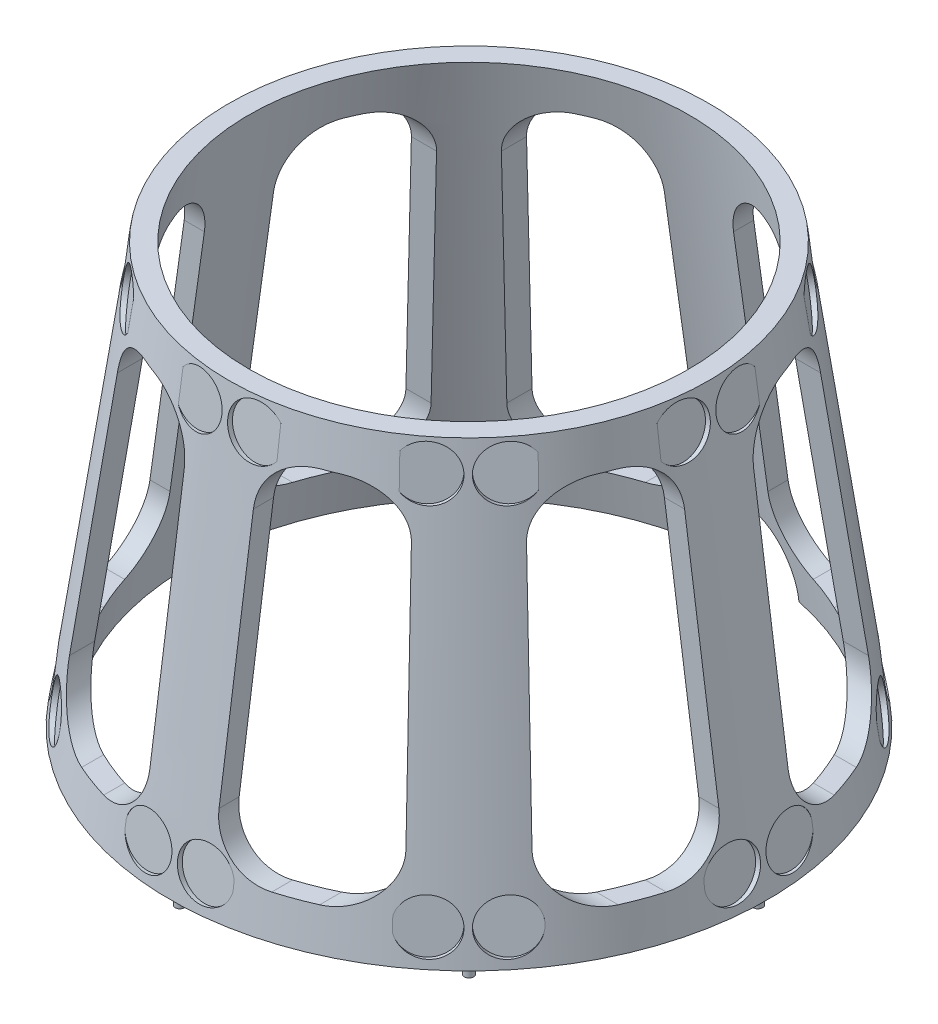
from build123d import *

# Parameters (mm, degrees)
SKIZZE2_R                            = 0.95
AUFSATZ_LINEAR_AUSTRAGEN1_DEPTH      = 2
SCHNITT_LINEAR_AUSTRAGEN1_DEPTH      = 121.644171765
SCHNITT_LINEAR_AUSTRAGEN1_DEPTH_BACK = 121.644171765
SCHNITT_LINEAR_AUSTRAGEN2_DEPTH      = 121.644171936
SCHNITT_LINEAR_AUSTRAGEN2_DEPTH_BACK = 121.644171936
SKIZZE6_R                            = 5.2
SCHNITT_LINEAR_AUSTRAGEN3_DEPTH      = 1
SKIZZE12_R                           = 5.2
SCHNITT_LINEAR_AUSTRAGEN7_DEPTH      = 1
SKIZZE14_R                           = 5.2
SCHNITT_LINEAR_AUSTRAGEN8_DEPTH      = 1
SKIZZE15_R                           = 5.2
SCHNITT_LINEAR_AUSTRAGEN9_DEPTH      = 1
SKIZZE16_R                           = 5.2
SCHNITT_LINEAR_AUSTRAGEN10_DEPTH     = 1
SKIZZE17_R                           = 5.2
SCHNITT_LINEAR_AUSTRAGEN11_DEPTH     = 1
SKIZZE18_R                           = 5.2
SCHNITT_LINEAR_AUSTRAGEN12_DEPTH     = 1
SKIZZE19_R                           = 5.2
SCHNITT_LINEAR_AUSTRAGEN13_DEPTH     = 1
SKIZZE20_R                           = 11.5
SCHNITT_LINEAR_AUSTRAGEN15_DEPTH     = 10


with BuildPart() as part:
    # Skizze1 → Rotation1 (revolve)
    with BuildSketch(Plane(origin=(0, 0, 0), x_dir=(0, 0, -1), z_dir=(1, 0, 0))):
        Polygon((56.5, 0), (44.55402905, 85), (48.59333934, 85), (60.53931029, 0), align=None)
    revolve(axis=Axis((0, 50.997537063, 0), (0, -1, 0)))

    # Skizze2 → Aufsatz-Linear austragen1 (add)
    with BuildSketch(Plane.XZ):
        with Locations((0, -58.5)):
            Circle(SKIZZE2_R)
        with Locations((-41.365746699, -41.365746699)):
            Circle(SKIZZE2_R)
        with Locations((-58.5, 0)):
            Circle(SKIZZE2_R)
        with Locations((-41.365746699, 41.365746699)):
            Circle(SKIZZE2_R)
        with Locations((0, 58.5)):
            Circle(SKIZZE2_R)
        with Locations((41.365746699, 41.365746699)):
            Circle(SKIZZE2_R)
        with Locations((58.5, 0)):
            Circle(SKIZZE2_R)
        with Locations((41.365746699, -41.365746699)):
            Circle(SKIZZE2_R)
    extrude(amount=AUFSATZ_LINEAR_AUSTRAGEN1_DEPTH)

    # Skizze3 → Schnitt-Linear austragen1 (cut, two sides: drawn at the far end of the back side and taken through both)
    with BuildSketch(Plane(origin=(0, 0, 0), x_dir=(0, 0, -1), z_dir=(1, 0, 0)).offset(-SCHNITT_LINEAR_AUSTRAGEN1_DEPTH_BACK)):
        with BuildLine():
            Line((-7, 67), (-7, 18))
            ThreePointArc((-7, 18), (-9.928932188, 10.928932188), (-17, 8))
            Line((-17, 8), (-24.086914989, 8))
            ThreePointArc((-24.086914989, 8), (-31.459688357, 11.244097924), (-34.04886197, 18.871557427))
            Line((-34.04886197, 18.871557427), (-29.761917457, 67.871557427))
            ThreePointArc((-29.761917457, 67.871557427), (-26.555872553, 74.372773368), (-19.799970477, 77))
            Line((-19.799970477, 77), (-17, 77))
            ThreePointArc((-17, 77), (-9.928932188, 74.071067812), (-7, 67))
        make_face()
        with BuildLine():
            Line((19.799970477, 77), (17, 77))
            ThreePointArc((17, 77), (9.928932188, 74.071067812), (7, 67))
            Line((7, 67), (7, 18))
            ThreePointArc((7, 18), (9.928932188, 10.928932188), (17, 8))
            Line((17, 8), (24.086914989, 8))
            ThreePointArc((24.086914989, 8), (31.459688357, 11.244097924), (34.04886197, 18.871557427))
            Line((34.04886197, 18.871557427), (29.761917457, 67.871557427))
            ThreePointArc((29.761917457, 67.871557427), (26.555872553, 74.372773368), (19.799970477, 77))
        make_face()
    extrude(amount=SCHNITT_LINEAR_AUSTRAGEN1_DEPTH + SCHNITT_LINEAR_AUSTRAGEN1_DEPTH_BACK, mode=Mode.SUBTRACT)

    # Skizze4 → Schnitt-Linear austragen2 (cut, two sides: drawn at the far end of the back side and taken through both)
    with BuildSketch(Plane.XY.offset(-SCHNITT_LINEAR_AUSTRAGEN2_DEPTH_BACK)):
        with BuildLine():
            Line((-7, 67), (-7, 18))
            ThreePointArc((-7, 18), (-9.928932188, 10.928932188), (-17, 8))
            Line((-17, 8), (-24.086914989, 8))
            ThreePointArc((-24.086914989, 8), (-31.459688357, 11.244097924), (-34.04886197, 18.871557427))
            Line((-34.04886197, 18.871557427), (-29.761917457, 67.871557427))
            ThreePointArc((-29.761917457, 67.871557427), (-26.555872553, 74.372773368), (-19.799970477, 77))
            Line((-19.799970477, 77), (-17, 77))
            ThreePointArc((-17, 77), (-9.928932188, 74.071067812), (-7, 67))
        make_face()
        with BuildLine():
            Line((17, 8), (24.086914989, 8))
            ThreePointArc((24.086914989, 8), (31.459688357, 11.244097924), (34.04886197, 18.871557427))
            Line((34.04886197, 18.871557427), (29.761917457, 67.871557427))
            ThreePointArc((29.761917457, 67.871557427), (26.555872553, 74.372773368), (19.799970477, 77))
            Line((19.799970477, 77), (17, 77))
            ThreePointArc((17, 77), (9.928932188, 74.071067812), (7, 67))
            Line((7, 67), (7, 18))
            ThreePointArc((7, 18), (9.928932188, 10.928932188), (17, 8))
        make_face()
    extrude(amount=SCHNITT_LINEAR_AUSTRAGEN2_DEPTH + SCHNITT_LINEAR_AUSTRAGEN2_DEPTH_BACK, mode=Mode.SUBTRACT)

    # Skizze6 → Schnitt-Linear austragen3 (cut)
    with BuildSketch(Plane(origin=(-59.366715185, 8.343447706, 0), x_dir=(0, 0, 1), z_dir=(-0.9902680687415708, 0.13917310096006222, 0))):
        with Locations((5.8, 71.492228289)):
            Circle(SKIZZE6_R)
        with Locations((5.8, -1.507771711)):
            Circle(SKIZZE6_R)
        with Locations((-5.8, 71.492228289)):
            Circle(SKIZZE6_R)
        with Locations((-5.8, -1.507771711)):
            Circle(SKIZZE6_R)
    extrude(amount=-SCHNITT_LINEAR_AUSTRAGEN3_DEPTH, mode=Mode.SUBTRACT)

    # Skizze12 → Schnitt-Linear austragen7 (cut)
    with BuildSketch(Plane(origin=(-41.978606884, 8.343447706, 41.978606884), x_dir=(0.6867913387506098, -0.13650304392840565, 0.7139219677355677), z_dir=(-0.7002252665996745, 0.13917310096006225, 0.7002252665996673))):
        with Locations((-4.219491712, 71.594055752)):
            Circle(SKIZZE12_R)
        with Locations((5.843159525, -0.709077307)):
            Circle(SKIZZE12_R)
        with Locations((-5.646105455, -2.308073942)):
            Circle(SKIZZE12_R)
        with Locations((-15.708756692, 69.995059117)):
            Circle(SKIZZE12_R)
    extrude(amount=-SCHNITT_LINEAR_AUSTRAGEN7_DEPTH, mode=Mode.SUBTRACT)

    # Skizze14 → Schnitt-Linear austragen8 (cut)
    with BuildSketch(Plane(origin=(0, 8.343447706, -59.366715185), x_dir=(-1, 0, 0), z_dir=(0, 0.13917310096006222, -0.9902680687415708))):
        with Locations((5.8, 71.492228289)):
            Circle(SKIZZE14_R)
        with Locations((-5.8, 71.492228289)):
            Circle(SKIZZE14_R)
    extrude(amount=-SCHNITT_LINEAR_AUSTRAGEN8_DEPTH, mode=Mode.SUBTRACT)

    # Skizze15 → Schnitt-Linear austragen9 (cut)
    with BuildSketch(Plane(origin=(59.366715185, 8.343447706, 0), x_dir=(0, 0, -1), z_dir=(0.9902680687415708, 0.13917310096006222, 0))):
        with Locations((5.8, 71.492228289)):
            Circle(SKIZZE15_R)
        with Locations((5.8, -1.507771711)):
            Circle(SKIZZE15_R)
        with Locations((-5.8, 71.492228289)):
            Circle(SKIZZE15_R)
        with Locations((-5.8, -1.507771711)):
            Circle(SKIZZE15_R)
    extrude(amount=-SCHNITT_LINEAR_AUSTRAGEN9_DEPTH, mode=Mode.SUBTRACT)

    # Skizze16 → Schnitt-Linear austragen10 (cut)
    with BuildSketch(Plane(origin=(0, 8.343447706, 59.366715185), x_dir=(1, 0, 0), z_dir=(0, 0.13917310096006222, 0.9902680687415708))):
        with Locations((5.8, 71.492228289)):
            Circle(SKIZZE16_R)
        with Locations((5.8, -1.507771711)):
            Circle(SKIZZE16_R)
        with Locations((-5.8, 71.492228289)):
            Circle(SKIZZE16_R)
        with Locations((-5.8, -1.507771711)):
            Circle(SKIZZE16_R)
    extrude(amount=-SCHNITT_LINEAR_AUSTRAGEN10_DEPTH, mode=Mode.SUBTRACT)

    # Skizze17 → Schnitt-Linear austragen11 (cut)
    with BuildSketch(Plane(origin=(41.978606884, 8.343447706, 41.978606884), x_dir=(0.7139219677355655, -0.13650304392840648, -0.6867913387506118), z_dir=(0.7002252665996695, 0.13917310096006222, 0.7002252665996724))):
        with Locations((-4.219491712, 71.594055752)):
            Circle(SKIZZE17_R)
        with Locations((5.843159525, -0.709077307)):
            Circle(SKIZZE17_R)
        with Locations((-5.646105455, -2.308073942)):
            Circle(SKIZZE17_R)
        with Locations((-15.708756692, 69.995059117)):
            Circle(SKIZZE17_R)
    extrude(amount=-SCHNITT_LINEAR_AUSTRAGEN11_DEPTH, mode=Mode.SUBTRACT)

    # Skizze18 → Schnitt-Linear austragen12 (cut)
    with BuildSketch(Plane(origin=(41.978606884, 8.343447706, -41.978606884), x_dir=(-0.6867913387506098, -0.1365030439284056, -0.7139219677355677), z_dir=(0.7002252665996747, 0.1391731009600622, -0.7002252665996673))):
        with Locations((-4.219491712, 71.594055752)):
            Circle(SKIZZE18_R)
        with Locations((5.843159525, -0.709077307)):
            Circle(SKIZZE18_R)
        with Locations((-5.646105455, -2.308073942)):
            Circle(SKIZZE18_R)
        with Locations((-15.708756692, 69.995059117)):
            Circle(SKIZZE18_R)
    extrude(amount=-SCHNITT_LINEAR_AUSTRAGEN12_DEPTH, mode=Mode.SUBTRACT)

    # Skizze19 → Schnitt-Linear austragen13 (cut)
    with BuildSketch(Plane(origin=(-41.978606884, 8.343447706, -41.978606884), x_dir=(-0.7139219677355655, -0.13650304392840648, 0.6867913387506118), z_dir=(-0.7002252665996695, 0.13917310096006222, -0.7002252665996724))):
        with Locations((-4.219491712, 71.594055752)):
            Circle(SKIZZE19_R)
        with Locations((5.843159525, -0.709077307)):
            Circle(SKIZZE19_R)
        with Locations((-5.646105455, -2.308073942)):
            Circle(SKIZZE19_R)
        with Locations((-15.708756692, 69.995059117)):
            Circle(SKIZZE19_R)
    extrude(amount=-SCHNITT_LINEAR_AUSTRAGEN13_DEPTH, mode=Mode.SUBTRACT)

    # Skizze20 → Schnitt-Linear austragen15 (cut)
    with BuildSketch(Plane(origin=(0, 8.343447706, -59.366715185), x_dir=(-1, 0, 0), z_dir=(0, 0.13917310096006222, -0.9902680687415708))):
        with Locations((0, -6.850335828)):
            Circle(SKIZZE20_R)
    extrude(amount=-SCHNITT_LINEAR_AUSTRAGEN15_DEPTH, mode=Mode.SUBTRACT)


solid = part.part
